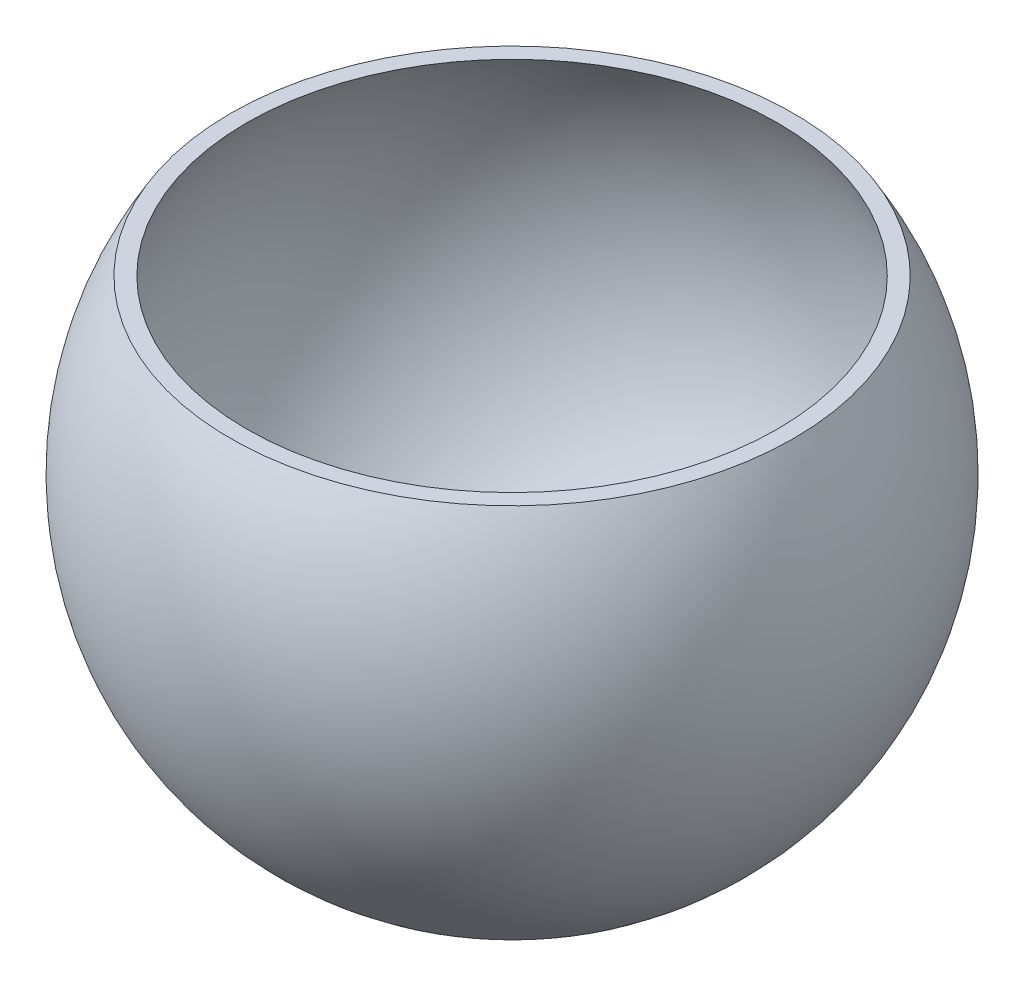
from build123d import *


with BuildPart() as part:
    # Sketch1 → Revolve1 (revolve)
    with BuildSketch(Plane.XY):
        with BuildLine():
            Line((130.175, 138.937866462), (122.679962198, 138.937866462))
            ThreePointArc((122.679962198, 138.937866462), (128.266827429, -10.154312008), (0, -86.360031775))
            Line((0, -86.360031775), (0, -92.710031775))
            ThreePointArc((0, -92.710031775), (132.859210617, -14.970531066), (130.175, 138.937866462))
        make_face()
    revolve(axis=Axis((0, 0, 0), (0, -1, 0)))


solid = part.part
